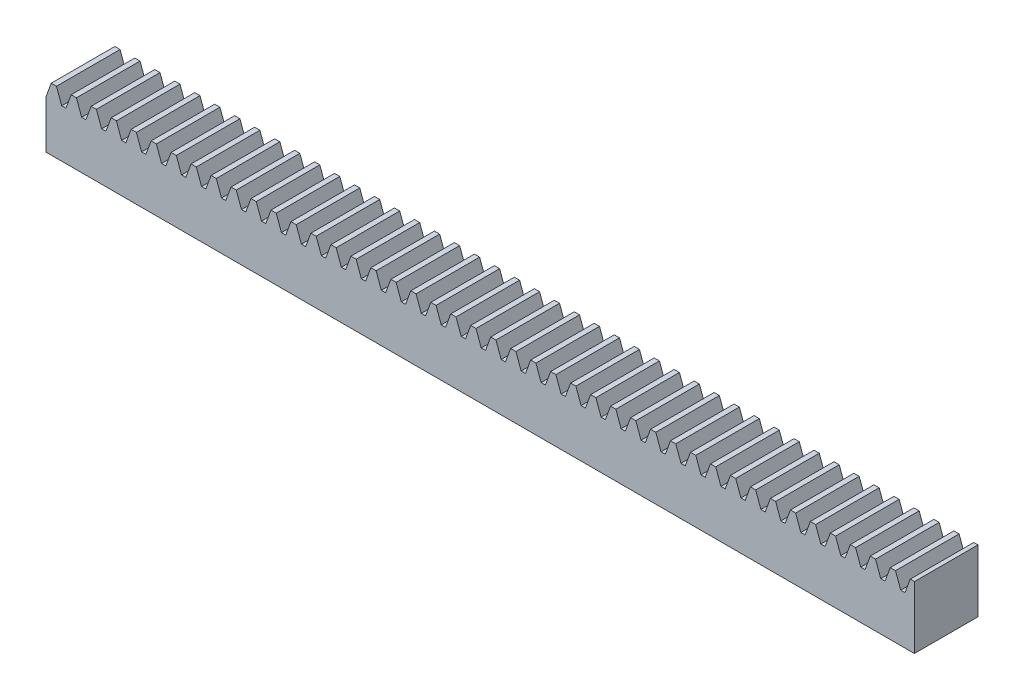
from build123d import *

# Parameters (mm, degrees)
RITNING_1_W          = 250
RITNING_1_H          = 9.8
KUGGST_NGS_MNE_DEPTH = 10
KUGGLUCKA_DEPTH      = 10
LPATTERN_COUNT       = 80
LPATTERN_PITCH       = 3.14159265
CUT_EXTRUDE1_DEPTH   = 10
CUT_EXTRUDE2_DEPTH   = 10
CUT_EXTRUDE3_DEPTH   = 10


with BuildPart() as part:
    # Ritning 1 → Kuggstångsämne (new body)
    with BuildSketch(Plane.XY):
        with Locations((0.9, 0)):
            Rectangle(RITNING_1_W, RITNING_1_H)
    extrude(amount=KUGGST_NGS_MNE_DEPTH)

    # Ritning 2 → Kugglucka (cut)
    with BuildSketch(Plane.XY.offset(10)):
        with BuildLine():
            Line((-124.438289352, 2.65), (-123.761710648, 2.65))
            Line((-123.761710648, 2.65), (-122.942777621, 4.9))
            Line((-122.942777621, 4.9), (-124.1, 6.057222379))
            Line((-124.1, 6.057222379), (-125.257222379, 4.9))
            add(Edge.make_bspline(
                [(-125.257222379, 4.9), (-124.984244704, 4.15), (-124.711267028, 3.4), (-124.438289352, 2.65)],
                knots=[0, 0, 0, 0, 1, 1, 1, 1], degree=3))
        make_face()
    kugglucka = extrude(amount=-KUGGLUCKA_DEPTH, mode=Mode.SUBTRACT)

    # LPattern: Kugglucka ×80
    with Locations(*[(i * LPATTERN_PITCH, 0, 0) for i in range(1, LPATTERN_COUNT)]):
        add(kugglucka, mode=Mode.SUBTRACT)

    # Sketch1 → Cut-Extrude1 (cut)
    with BuildSketch(Plane.XY.offset(10)):
        Polygon((-14.1, -4.9), (-14.1, 28.842598561), (-144.155901294, 20.311788427), (-144.155901294, -37.128999809), (-16.762469959, -41.110044539), align=None)
    extrude(amount=-CUT_EXTRUDE1_DEPTH, mode=Mode.SUBTRACT)

    # Sketch2 → Cut-Extrude2 (cut)
    with BuildSketch(Plane.XY.offset(10)):
        Polygon((-14.1, -4.9), (-12.1, -4.9), (-12.1, 6.448681212), (-16.786179273, 6.448681212), align=None)
    extrude(amount=-CUT_EXTRUDE2_DEPTH, mode=Mode.SUBTRACT)

    # Sketch3 → Cut-Extrude3 (cut)
    with BuildSketch(Plane.XY.offset(10)):
        Polygon((-10.664375248, 2.65), (-10.664375248, -7.082217472), (-18.08969738, -7.082217472), (-18.08969738, 10.597993007), (-10.254908734, 10.597993007), align=None)
    extrude(amount=-CUT_EXTRUDE3_DEPTH, mode=Mode.SUBTRACT)


solid = part.part
